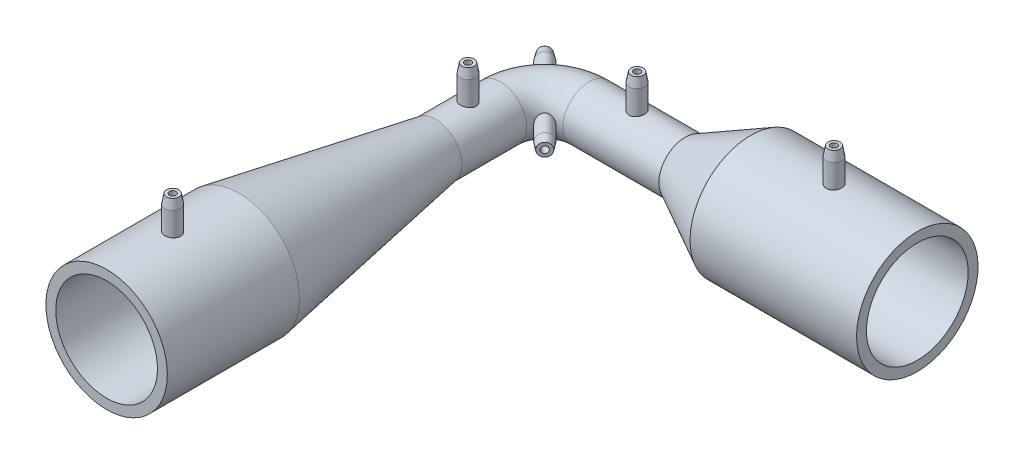
from build123d import *

# Parameters (mm, degrees)
SKETCH17_R                      = 8
SKETCH17_R_2                    = 5
REVOLVE13_ANGLE                 = 90
SKETCH4_6_W                     = 1.385
SKETCH4_6_H                     = 11.5
SKETCH4_7_W                     = 1.385
SKETCH4_7_H                     = 11.5
SKETCH20_3_W                    = 1.358
SKETCH20_3_H                    = 11.5
SKETCH20_4_W                    = 1.385
SKETCH20_4_H                    = 11.5
CHAMFER1_SIZE                   = 0.5
CHAMFER1_SIZE2                  = 2.83564091
CHAMFER2_SIZE                   = 0.5
CHAMFER2_SIZE2                  = 2.83564091
CHAMFER3_SIZE                   = 0.5
CHAMFER3_SIZE2                  = 2.83564091
CHAMFER4_SIZE                   = 0.5
CHAMFER4_SIZE2                  = 2.83564091
CUT_EXTRUDE1_REACH              = 193.829
SKETCH23_R                      = 1
BOSS_EXTRUDE2_DEPTH             = 10
BOSS_EXTRUDE2_DEPTH_BACK        = 2
SKETCH25_R                      = 2.385
SKETCH26_R                      = 2.385
BOSS_EXTRUDE4_DEPTH             = 10
BOSS_EXTRUDE4_DIRECTION_2_REACH = 204.236
CUT_EXTRUDE2_DEPTH              = 203.235519351
CUT_EXTRUDE2_DEPTH_BACK         = 203.235519351
SKETCH26_3_R                    = 1
CHAMFER5_SIZE                   = 0.5
CHAMFER5_SIZE2                  = 2.83564091
CHAMFER8_SIZE                   = 3
CHAMFER8_SIZE2                  = 0.421622504


with BuildPart() as part:
    # Sketch4 → Revolve5 (revolve)
    with BuildSketch(Plane(origin=(0, 0, 0), x_dir=(0, 0, -1), z_dir=(1, 0, 0))):
        Polygon((0, 15.5), (40, 15.5), (100, 5), (120, 5), (120, 8), (100.260520432, 8), (40.260520432, 18.5), (0, 18.5), align=None)
    revolve(axis=Axis((0, 0, 0), (0, 0, -1)))

    # Sketch17 → Revolve13 (revolve)
    with BuildSketch(Plane(origin=(0, 0, -120), x_dir=(-1, 0, 0), z_dir=(0, 0, -1))):
        Circle(SKETCH17_R)
        Circle(SKETCH17_R_2, mode=Mode.SUBTRACT)
    revolve(axis=Axis((13.5, -15.971128143, -120), (0, -1, 0)), revolution_arc=REVOLVE13_ANGLE)

    # Sketch20 → Revolve14 (revolve)
    with BuildSketch(Plane.XY.offset(-133.5)):
        Polygon((13.5, 5), (43.5, 5), (63.5, 15.5), (113.5, 15.5), (113.5, 18.5), (62.76036743, 18.5), (42.76036743, 8), (13.5, 8), align=None)
    revolve(axis=Axis((13.5, 0, -133.5), (1, 0, 0)))

    # Sketch4<6> → Revolve15 (revolve)
    with BuildSketch(Plane(origin=(0, 0, 0), x_dir=(0, 0, -1), z_dir=(1, 0, 0))):
        with Locations((21.822760216, 22.75)):
            Rectangle(SKETCH4_6_W, SKETCH4_6_H)
    revolve(axis=Axis((0, 18.5, -20.130260216), (0, 1, 0)))

    # Sketch4<7> → Revolve16 (revolve)
    with BuildSketch(Plane(origin=(0, 0, 0), x_dir=(0, 0, -1), z_dir=(1, 0, 0))):
        with Locations((111.822760216, 12.25)):
            Rectangle(SKETCH4_7_W, SKETCH4_7_H)
    revolve(axis=Axis((0, 8, -110.130260216), (0, 1, 0)))

    # Sketch20<3> → Revolve17 (revolve)
    with BuildSketch(Plane.XY.offset(-133.5)):
        with Locations((89.809183715, 22.75)):
            Rectangle(SKETCH20_3_W, SKETCH20_3_H)
    revolve(axis=Axis((88.130183715, 18.5, -133.5), (0, 1, 0)))

    # Sketch20<4> → Revolve18 (revolve)
    with BuildSketch(Plane.XY.offset(-133.5)):
        with Locations((29.822683715, 12.25)):
            Rectangle(SKETCH20_4_W, SKETCH20_4_H)
    revolve(axis=Axis((28.130183715, 8, -133.5), (0, 1, 0)))

    # Chamfer1
    chamfer1_edges = [part.edges().sort_by_distance(p)[0] for p in [
        (0, 18, -107.745260216),
    ]]
    chamfer1_side = [part.faces().sort_by_distance(p)[0] for p in [
        (0, 18, -107.812718203),
    ]]
    chamfer(chamfer1_edges, length=CHAMFER1_SIZE, length2=CHAMFER1_SIZE2, reference=chamfer1_side[0])

    # Chamfer2
    chamfer2_edges = [part.edges().sort_by_distance(p)[0] for p in [
        (0, 28.5, -17.745260216),
    ]]
    chamfer2_side = [part.faces().sort_by_distance(p)[0] for p in [
        (0, 28.5, -17.812718203),
    ]]
    chamfer(chamfer2_edges, length=CHAMFER2_SIZE, length2=CHAMFER2_SIZE2, reference=chamfer2_side[0])

    # Chamfer3
    chamfer3_edges = [part.edges().sort_by_distance(p)[0] for p in [
        (25.745183715, 18, -133.5),
    ]]
    chamfer3_side = [part.faces().sort_by_distance(p)[0] for p in [
        (25.812641702, 18, -133.5),
    ]]
    chamfer(chamfer3_edges, length=CHAMFER3_SIZE, length2=CHAMFER3_SIZE2, reference=chamfer3_side[0])

    # Chamfer4
    chamfer4_edges = [part.edges().sort_by_distance(p)[0] for p in [
        (85.772183715, 28.5, -133.5),
    ]]
    chamfer4_side = [part.faces().sort_by_distance(p)[0] for p in [
        (85.838878026, 28.5, -133.5),
    ]]
    chamfer(chamfer4_edges, length=CHAMFER4_SIZE, length2=CHAMFER4_SIZE2, reference=chamfer4_side[0])

    # Sketch23 → Cut-Extrude1 (cut, up to next)
    with BuildSketch(Plane(origin=(0, 0, 0), x_dir=(1, 0, 0), z_dir=(0, 1, 0)), mode=Mode.PRIVATE) as cut_extrude1_sk1:
        with Locations((0, 20.130260216)):
            Circle(SKETCH23_R)
    cut_extrude1_tool1 = extrude(cut_extrude1_sk1.sketch, amount=CUT_EXTRUDE1_REACH, mode=Mode.PRIVATE) & part.part
    # Sketch23 → Cut-Extrude1 (cut, up to next)
    with BuildSketch(Plane(origin=(0, 0, 0), x_dir=(1, 0, 0), z_dir=(0, 1, 0)), mode=Mode.PRIVATE) as cut_extrude1_sk2:
        with Locations((0, 110.130260216)):
            Circle(SKETCH23_R)
    cut_extrude1_tool2 = extrude(cut_extrude1_sk2.sketch, amount=CUT_EXTRUDE1_REACH, mode=Mode.PRIVATE) & part.part
    # Sketch23 → Cut-Extrude1 (cut, up to next)
    with BuildSketch(Plane(origin=(0, 0, 0), x_dir=(1, 0, 0), z_dir=(0, 1, 0)), mode=Mode.PRIVATE) as cut_extrude1_sk3:
        with Locations((28.130183715, 133.5)):
            Circle(SKETCH23_R)
    cut_extrude1_tool3 = extrude(cut_extrude1_sk3.sketch, amount=CUT_EXTRUDE1_REACH, mode=Mode.PRIVATE) & part.part
    # Sketch23 → Cut-Extrude1 (cut, up to next)
    with BuildSketch(Plane(origin=(0, 0, 0), x_dir=(1, 0, 0), z_dir=(0, 1, 0)), mode=Mode.PRIVATE) as cut_extrude1_sk4:
        with Locations((88.130183715, 133.5)):
            Circle(SKETCH23_R)
    cut_extrude1_tool4 = extrude(cut_extrude1_sk4.sketch, amount=CUT_EXTRUDE1_REACH, mode=Mode.PRIVATE) & part.part
    add(cut_extrude1_tool1.solids().sort_by_distance((0, 0, -20.13026))[0], mode=Mode.SUBTRACT)
    add(cut_extrude1_tool2.solids().sort_by_distance((0, 0, -110.13026))[0], mode=Mode.SUBTRACT)
    add(cut_extrude1_tool3.solids().sort_by_distance((28.130184, 0, -133.5))[0], mode=Mode.SUBTRACT)
    add(cut_extrude1_tool4.solids().sort_by_distance((88.130184, 0, -133.5))[0], mode=Mode.SUBTRACT)

    # Sketch25 → Boss-Extrude2 (add, two sides: drawn at the far end of the back side and taken through both)
    with BuildSketch(Plane(origin=(-57.139087297, 0, -57.139087297), x_dir=(0.7071067811865496, 0, -0.7071067811865455), z_dir=(0.7071067811865455, 0, 0.7071067811865496)).offset(-BOSS_EXTRUDE2_DEPTH_BACK)):
        with Locations((94.398755288, 0)):
            Circle(SKETCH25_R)
    extrude(amount=BOSS_EXTRUDE2_DEPTH + BOSS_EXTRUDE2_DEPTH_BACK)


with BuildPart() as body_2:
    # Sketch26 → Boss-Extrude4 (new body)
    with BuildSketch(Plane(origin=(-68.452795796, 0, -68.452795796), x_dir=(0.707106781186549, 0, -0.707106781186546), z_dir=(-0.707106781186546, 0, -0.707106781186549))):
        with Locations((94.398755288, 0)):
            Circle(SKETCH26_R)
    extrude(amount=BOSS_EXTRUDE4_DEPTH)


    # Sketch26 → Boss-Extrude4 direction 2 (add, up to next)
    with BuildSketch(Plane(origin=(-68.452795796, 0, -68.452795796), x_dir=(0.707106781186549, 0, -0.707106781186546), z_dir=(-0.707106781186546, 0, -0.707106781186549)), mode=Mode.PRIVATE) as boss_extrude4_direction_2_sk1:
        with Locations((94.398755288, 0)):
            Circle(SKETCH26_R)
    boss_extrude4_direction_2_tool1 = extrude(boss_extrude4_direction_2_sk1.sketch, amount=-BOSS_EXTRUDE4_DIRECTION_2_REACH, mode=Mode.PRIVATE) - part.part
    add(boss_extrude4_direction_2_tool1.solids().sort_by_distance((-1.702796, 0, -135.202796))[0])


with BuildPart() as cut_extrude2_tool:
    # Sketch26<3> → Cut-Extrude2 (new, two sides: drawn at the far end of the back side and taken through both)
    with BuildSketch(Plane(origin=(-68.452795796, 0, -68.452795796), x_dir=(0.707106781186549, 0, -0.707106781186546), z_dir=(-0.707106781186546, 0, -0.707106781186549)).offset(-CUT_EXTRUDE2_DEPTH_BACK)):
        with Locations((94.398755288, 0)):
            Circle(SKETCH26_3_R)
    extrude(amount=CUT_EXTRUDE2_DEPTH + CUT_EXTRUDE2_DEPTH_BACK)


with BuildPart() as part_1:
    add(part.part)

    # Cut-Extrude2: cut by cut_extrude2_tool
    add(cut_extrude2_tool.part, mode=Mode.SUBTRACT)

    # Chamfer8
    chamfer8_edges = [part_1.edges().sort_by_distance(p)[0] for p in [
        (14.995530842, 0, -115.131569812),
    ]]
    chamfer8_side = [part_1.faces().sort_by_distance(p)[0] for p in [
        (11.331363024, 0, -118.79573763),
    ]]
    chamfer(chamfer8_edges, length=CHAMFER8_SIZE, length2=CHAMFER8_SIZE2, reference=chamfer8_side[0])


with BuildPart() as body_2_1:
    add(body_2.part)

    # Cut-Extrude2: cut by cut_extrude2_tool
    add(cut_extrude2_tool.part, mode=Mode.SUBTRACT)

    # Chamfer5
    chamfer5_edges = [body_2_1.edges().sort_by_distance(p)[0] for p in [
        (-10.460313281, 0, -140.587413934),
    ]]
    chamfer5_side = [body_2_1.faces().sort_by_distance(p)[0] for p in [
        (-10.412613281, 0, -140.635113934),
    ]]
    chamfer(chamfer5_edges, length=CHAMFER5_SIZE, length2=CHAMFER5_SIZE2, reference=chamfer5_side[0])


solid = Compound([part_1.part, body_2_1.part])
